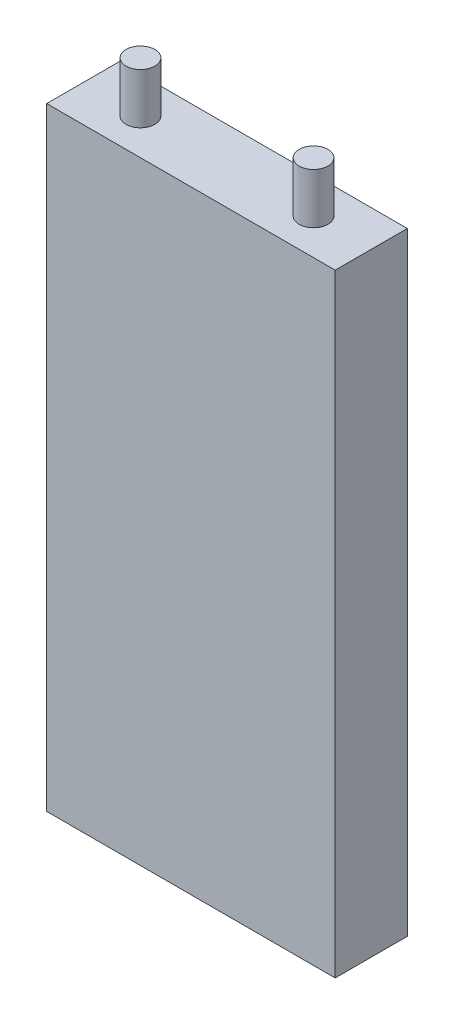
from build123d import *

# Parameters (mm, degrees)
SKETCH1_W           = 101.6
SKETCH1_H           = 25.4
BOSS_EXTRUDE1_DEPTH = 215.9
SKETCH2_R           = 5.08
BOSS_EXTRUDE2_DEPTH = 17.78


with BuildPart() as part:
    # Sketch1 → Boss-Extrude1 (new body)
    with BuildSketch(Plane(origin=(0, 0, 0), x_dir=(1, 0, 0), z_dir=(0, 1, 0))):
        with Locations((29.457987906, 2.028993953)):
            Rectangle(SKETCH1_W, SKETCH1_H)
    extrude(amount=BOSS_EXTRUDE1_DEPTH)

    # Sketch2 → Boss-Extrude2 (add)
    with BuildSketch(Plane(origin=(0, 215.9, 0), x_dir=(1, 0, 0), z_dir=(0, 1, 0))):
        with Locations((-1.022012094, 2.028993953)):
            Circle(SKETCH2_R)
        with Locations((59.937987906, 2.028993953)):
            Circle(SKETCH2_R)
    extrude(amount=BOSS_EXTRUDE2_DEPTH)


solid = part.part
